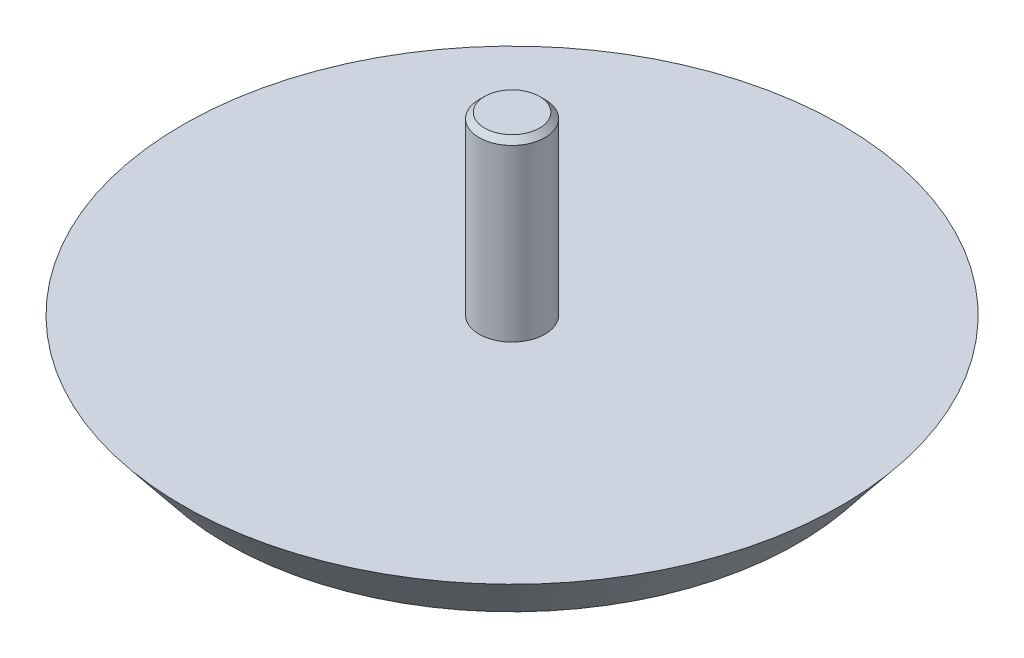
from build123d import *

# Parameters (mm, degrees)
ESQUISSE1_R        = 3
BOSS_EXTRU_1_DEPTH = 16
CHANFREIN1_SIZE    = 0.5


with BuildPart() as part:
    # Esquisse1 → Boss.-Extru.1 (new body)
    with BuildSketch(Plane(origin=(0, 0, 0), x_dir=(1, 0, 0), z_dir=(0, 1, 0))):
        Circle(ESQUISSE1_R)
    extrude(amount=BOSS_EXTRU_1_DEPTH)

    # Esquisse4 → Révolution1 (revolve)
    with BuildSketch(Plane(origin=(0, 0, 0), x_dir=(0, 0, -1), z_dir=(1, 0, 0))):
        Polygon((0, 0), (30, 0), (26, -5), (0, -5), align=None)
    revolve(axis=Axis((0, -5, 0), (0, 1, 0)))

    # Chanfrein1
    chanfrein1_edges = [part.edges().sort_by_distance(p)[0] for p in [
        (-3, 16, 0),
    ]]
    chamfer(chanfrein1_edges, length=CHANFREIN1_SIZE)


solid = part.part
